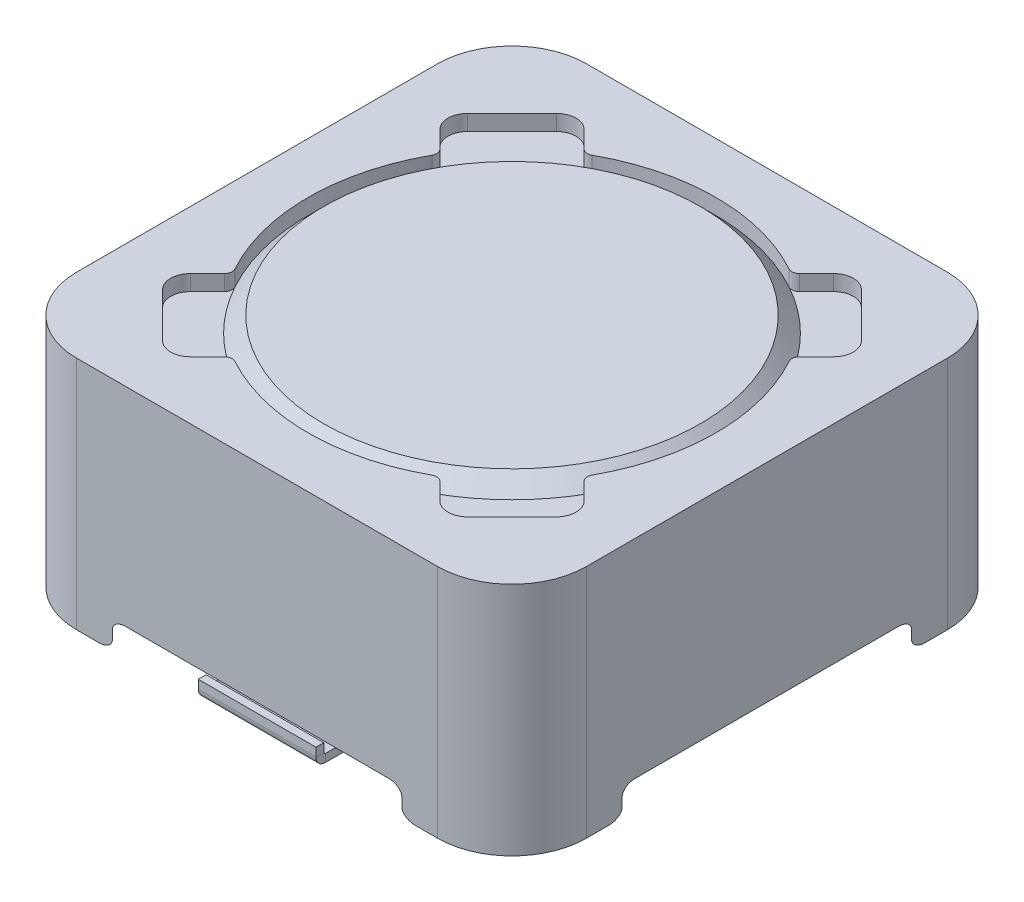
from build123d import *

# Parameters (mm, degrees)
BOSS_EXTRUDE1_DEPTH = 3
CUT_EXTRUDE1_DEPTH  = 0.2
SKETCH3_R           = 2.4
BOSS_EXTRUDE2_DEPTH = 0.2
CHAMFER2_SIZE       = 0.2
CUT_EXTRUDE2_DEPTH  = 0.35
FILLET1_R           = 0.12
CUT_EXTRUDE3_START  = -0.2
CUT_EXTRUDE3_DEPTH  = 0.2
SKETCH7_R           = 2.3
BOSS_EXTRUDE3_DEPTH = 0.3
CHAMFER3_SIZE       = 0.3
BOSS_EXTRUDE4_DEPTH = 0.1
SKETCH10_W          = 1.5
SKETCH10_H          = 0.1
SKETCH11_W          = 1.5
SKETCH11_H          = 0.1
BOSS_EXTRUDE5_DEPTH = 0.125718509
CIRPATTERN1_COUNT   = 2


with BuildPart() as part:
    # Sketch1 → Boss-Extrude1 (new body)
    with BuildSketch(Plane(origin=(0, 0, 0), x_dir=(1, 0, 0), z_dir=(0, 1, 0))):
        with BuildLine():
            Line((-2.3, 3.25), (2.3, 3.25))
            ThreePointArc((2.3, 3.25), (2.971751442, 2.971751442), (3.25, 2.3))
            Line((3.25, 2.3), (3.25, -2.3))
            ThreePointArc((3.25, -2.3), (2.971751442, -2.971751442), (2.3, -3.25))
            Line((2.3, -3.25), (-2.3, -3.25))
            ThreePointArc((-2.3, -3.25), (-2.971751442, -2.971751442), (-3.25, -2.3))
            Line((-3.25, -2.3), (-3.25, 2.3))
            ThreePointArc((-3.25, 2.3), (-2.971751442, 2.971751442), (-2.3, 3.25))
        make_face()
    extrude(amount=BOSS_EXTRUDE1_DEPTH)

    # Sketch2 → Cut-Extrude1 (cut)
    with BuildSketch(Plane(origin=(0, 3, 0), x_dir=(1, 0, 0), z_dir=(0, 1, 0))):
        with BuildLine():
            Line((-1.374433481, 2.293672297), (-1.590990258, 2.510229073))
            ThreePointArc((-1.590990258, 2.510229073), (-1.767766953, 2.583452378), (-1.944543648, 2.510229073))
            Line((-1.944543648, 2.510229073), (-2.510229073, 1.944543648))
            ThreePointArc((-2.510229073, 1.944543648), (-2.583452378, 1.767766953), (-2.510229073, 1.590990258))
            Line((-2.510229073, 1.590990258), (-2.293672297, 1.374433481))
            ThreePointArc((-2.293672297, 1.374433481), (-2.265371729, 1.31775039), (-2.276813235, 1.255436773))
            ThreePointArc((-2.276813235, 1.255436773), (-2.6, 0), (-2.276813235, -1.255436773))
            ThreePointArc((-2.276813235, -1.255436773), (-2.265371729, -1.31775039), (-2.293672297, -1.374433481))
            Line((-2.293672297, -1.374433481), (-2.510229073, -1.590990258))
            ThreePointArc((-2.510229073, -1.590990258), (-2.583452378, -1.767766953), (-2.510229073, -1.944543648))
            Line((-2.510229073, -1.944543648), (-1.944543648, -2.510229073))
            ThreePointArc((-1.944543648, -2.510229073), (-1.767766953, -2.583452378), (-1.590990258, -2.510229073))
            Line((-1.590990258, -2.510229073), (-1.374433481, -2.293672297))
            ThreePointArc((-1.374433481, -2.293672297), (-1.31775039, -2.265371729), (-1.255436773, -2.276813235))
            ThreePointArc((-1.255436773, -2.276813235), (0, -2.6), (1.255436773, -2.276813235))
            ThreePointArc((1.255436773, -2.276813235), (1.31775039, -2.265371729), (1.374433481, -2.293672297))
            Line((1.374433481, -2.293672297), (1.590990258, -2.510229073))
            ThreePointArc((1.590990258, -2.510229073), (1.767766953, -2.583452378), (1.944543648, -2.510229073))
            Line((1.944543648, -2.510229073), (2.510229073, -1.944543648))
            ThreePointArc((2.510229073, -1.944543648), (2.583452378, -1.767766953), (2.510229073, -1.590990258))
            Line((2.510229073, -1.590990258), (2.293672297, -1.374433481))
            ThreePointArc((2.293672297, -1.374433481), (2.265371729, -1.31775039), (2.276813235, -1.255436773))
            ThreePointArc((2.276813235, -1.255436773), (2.6, 0), (2.276813235, 1.255436773))
            ThreePointArc((2.276813235, 1.255436773), (2.265371729, 1.31775039), (2.293672297, 1.374433481))
            Line((2.293672297, 1.374433481), (2.510229073, 1.590990258))
            ThreePointArc((2.510229073, 1.590990258), (2.583452378, 1.767766953), (2.510229073, 1.944543648))
            Line((2.510229073, 1.944543648), (1.944543648, 2.510229073))
            ThreePointArc((1.944543648, 2.510229073), (1.767766953, 2.583452378), (1.590990258, 2.510229073))
            Line((1.590990258, 2.510229073), (1.374433481, 2.293672297))
            ThreePointArc((1.374433481, 2.293672297), (1.31775039, 2.265371729), (1.255436773, 2.276813235))
            ThreePointArc((1.255436773, 2.276813235), (0, 2.6), (-1.255436773, 2.276813235))
            ThreePointArc((-1.255436773, 2.276813235), (-1.31775039, 2.265371729), (-1.374433481, 2.293672297))
        make_face()
    extrude(amount=-CUT_EXTRUDE1_DEPTH, mode=Mode.SUBTRACT)

    # Sketch3 → Boss-Extrude2 (add)
    with BuildSketch(Plane(origin=(0, 2.8, 0), x_dir=(1, 0, 0), z_dir=(0, 1, 0))):
        with Locations(Location((0, 0, 0), (0, 0, 90))):
            Circle(SKETCH3_R)
    extrude(amount=BOSS_EXTRUDE2_DEPTH)

    # Chamfer2
    chamfer2_edges = [part.edges().sort_by_distance(p)[0] for p in [
        (0, 2.8, 2.4),
    ]]
    chamfer(chamfer2_edges, length=CHAMFER2_SIZE - 0.0001)  # a hair under: the kernel refuses the full size

    # Sketch4 → Cut-Extrude2 (cut)
    with BuildSketch(Plane.XZ):
        Polygon((-3.25, 1.844974747), (-1.844974747, 3.25), (1.844974747, 3.25), (3.25, 1.844974747), (3.25, -1.844974747), (1.844974747, -3.25), (-1.844974747, -3.25), (-3.25, -1.844974747), align=None)
    extrude(amount=-CUT_EXTRUDE2_DEPTH, mode=Mode.SUBTRACT)

    # Fillet1
    fillet1_edges = [part.edges().sort_by_distance(p)[0] for p in [
        (-2.547487373, 0.35, 2.547487373),
        (2.547487373, 0.35, 2.547487373),
        (2.547487373, 0.35, -2.547487373),
        (-2.547487373, 0.35, -2.547487373),
        (-2.547487373, 0, -2.547487373),
        (2.547487373, 0, -2.547487373),
        (2.547487373, 0, 2.547487373),
        (-2.547487373, 0, 2.547487373),
    ]]
    fillet(fillet1_edges, radius=FILLET1_R)

    # Sketch6 → Cut-Extrude3 (cut)
    with BuildSketch(Plane.XZ.offset(-0.35).offset(CUT_EXTRUDE3_START)):
        with BuildLine():
            Line((-2.293672297, 1.374433481), (-2.451849754, 1.532610938))
            ThreePointArc((-2.451849754, 1.532610938), (-2.525073059, 1.709387634), (-2.451849754, 1.886164329))
            Line((-2.451849754, 1.886164329), (-1.886164329, 2.451849754))
            ThreePointArc((-1.886164329, 2.451849754), (-1.709387634, 2.525073059), (-1.532610938, 2.451849754))
            Line((-1.532610938, 2.451849754), (-1.374433481, 2.293672297))
            ThreePointArc((-1.374433481, 2.293672297), (-1.31775039, 2.265371729), (-1.255436773, 2.276813235))
            ThreePointArc((-1.255436773, 2.276813235), (0, 2.6), (1.255436773, 2.276813235))
            ThreePointArc((1.255436773, 2.276813235), (1.31775039, 2.265371729), (1.374433481, 2.293672297))
            Line((1.374433481, 2.293672297), (1.532610938, 2.451849754))
            ThreePointArc((1.532610938, 2.451849754), (1.709387634, 2.525073059), (1.886164329, 2.451849754))
            Line((1.886164329, 2.451849754), (2.451849754, 1.886164329))
            ThreePointArc((2.451849754, 1.886164329), (2.525073059, 1.709387634), (2.451849754, 1.532610938))
            Line((2.451849754, 1.532610938), (2.293672297, 1.374433481))
            ThreePointArc((2.293672297, 1.374433481), (2.265371729, 1.31775039), (2.276813235, 1.255436773))
            ThreePointArc((2.276813235, 1.255436773), (2.6, 0), (2.276813235, -1.255436773))
            ThreePointArc((2.276813235, -1.255436773), (2.265371729, -1.31775039), (2.293672297, -1.374433481))
            Line((2.293672297, -1.374433481), (2.451849754, -1.532610938))
            ThreePointArc((2.451849754, -1.532610938), (2.525073059, -1.709387634), (2.451849754, -1.886164329))
            Line((2.451849754, -1.886164329), (1.886164329, -2.451849754))
            ThreePointArc((1.886164329, -2.451849754), (1.709387634, -2.525073059), (1.532610938, -2.451849754))
            Line((1.532610938, -2.451849754), (1.374433481, -2.293672297))
            ThreePointArc((1.374433481, -2.293672297), (1.31775039, -2.265371729), (1.255436773, -2.276813235))
            ThreePointArc((1.255436773, -2.276813235), (0, -2.6), (-1.255436773, -2.276813235))
            ThreePointArc((-1.255436773, -2.276813235), (-1.31775039, -2.265371729), (-1.374433481, -2.293672297))
            Line((-1.374433481, -2.293672297), (-1.532610938, -2.451849754))
            ThreePointArc((-1.532610938, -2.451849754), (-1.709387634, -2.525073059), (-1.886164329, -2.451849754))
            Line((-1.886164329, -2.451849754), (-2.451849754, -1.886164329))
            ThreePointArc((-2.451849754, -1.886164329), (-2.525073059, -1.709387634), (-2.451849754, -1.532610938))
            Line((-2.451849754, -1.532610938), (-2.293672297, -1.374433481))
            ThreePointArc((-2.293672297, -1.374433481), (-2.265371729, -1.31775039), (-2.276813235, -1.255436773))
            ThreePointArc((-2.276813235, -1.255436773), (-2.6, 0), (-2.276813235, 1.255436773))
            ThreePointArc((-2.276813235, 1.255436773), (-2.265371729, 1.31775039), (-2.293672297, 1.374433481))
        make_face()
    extrude(amount=CUT_EXTRUDE3_DEPTH, mode=Mode.SUBTRACT)

    # Sketch7 → Boss-Extrude3 (add)
    with BuildSketch(Plane.XZ.offset(-0.55)):
        with Locations(Location((0, 0, 0), (0, 0, 90))):
            Circle(SKETCH7_R)
    extrude(amount=BOSS_EXTRUDE3_DEPTH)

    # Chamfer3
    chamfer3_edges = [part.edges().sort_by_distance(p)[0] for p in [
        (0, 0.55, -2.3),
    ]]
    chamfer(chamfer3_edges, length=CHAMFER3_SIZE - 0.0001)  # a hair under: the kernel refuses the full size

    # Sketch8 → Boss-Extrude4 (add)
    with BuildSketch(Plane.XZ.offset(-0.25)):
        with BuildLine():
            Line((-2.3, 0), (2.131605875, 0.863861328))
            ThreePointArc((2.131605875, 0.863861328), (-0.4400605, 2.257508971), (-2.3, 0))
        make_face()
    boss_extrude4 = extrude(amount=BOSS_EXTRUDE4_DEPTH)



with BuildPart() as body_2:
    # Sweep2: sweep along a path in Sketch9
    with BuildLine(Plane(origin=(0, 0, 0), x_dir=(0, 0, -1), z_dir=(1, 0, 0))) as sweep2_path:
        Line((-2.3, 0.2), (-2.45, 0.2))
        ThreePointArc((-2.45, 0.2), (-2.499497475, 0.179497475), (-2.52, 0.13))
        Line((-2.52, 0.13), (-2.52, 0.12))
        ThreePointArc((-2.52, 0.12), (-2.540502525, 0.070502525), (-2.59, 0.05))
        Line((-2.59, 0.05), (-3.13, 0.05))
        ThreePointArc((-3.13, 0.05), (-3.179497475, 0.070502525), (-3.2, 0.12))
        Line((-3.2, 0.12), (-3.2, 0.23))
    # Sketch10 → Sweep2 (sweep)
    with BuildSketch(Plane.XY.offset(2.3)):
        with Locations((0, 0.2)):
            Rectangle(SKETCH10_W, SKETCH10_H)
    sweep2 = sweep(path=sweep2_path.line)


with BuildPart() as part_1:
    add(part.part)

    add(body_2.part)  # Boss-Extrude5 merges body 2
    # Sketch11 → Boss-Extrude5 (add)
    with BuildSketch(Plane(origin=(0, 0, 2.3), x_dir=(-1, 0, 0), z_dir=(0, 0, -1))):
        with Locations((0, 0.2)):
            Rectangle(SKETCH11_W, SKETCH11_H)
    boss_extrude5 = extrude(amount=BOSS_EXTRUDE5_DEPTH)

    # CirPattern1: Boss-Extrude4, Sweep2, Boss-Extrude5 ×2 about axis
    cirpattern1_axis = Axis((0, 0, 0), (0, 1, 0))
    add([boss_extrude4.rotate(cirpattern1_axis, i * 360 / CIRPATTERN1_COUNT) for i in range(1, CIRPATTERN1_COUNT)])
    add([sweep2.rotate(cirpattern1_axis, i * 360 / CIRPATTERN1_COUNT) for i in range(1, CIRPATTERN1_COUNT)])
    add([boss_extrude5.rotate(cirpattern1_axis, i * 360 / CIRPATTERN1_COUNT) for i in range(1, CIRPATTERN1_COUNT)])


solid = part_1.part
